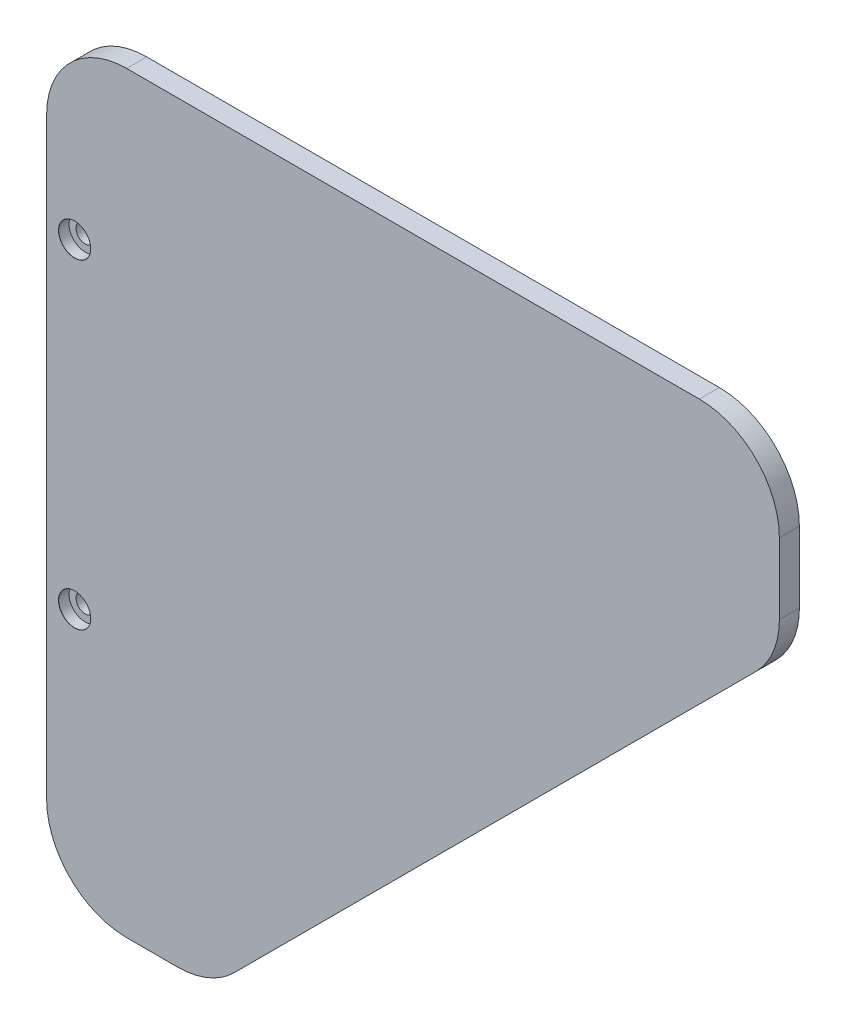
from build123d import *

# Parameters (mm, degrees)
ESTRUSIONE_ESTRUSIONE1_DEPTH                 = 5
FORO_LAMATO_PER_VITE_M4_A_TESTA_CILI_2_COUNT = 2
FORO_LAMATO_PER_VITE_M4_A_TESTA_CILI_2_PITCH = 80


with BuildPart() as part:
    # Schizzo1 → Estrusione-Estrusione1 (new body)
    with BuildSketch(Plane.XY):
        with BuildLine():
            Line((0, 20), (0, 168))
            ThreePointArc((0, 168), (5.857864376, 182.142135624), (20, 188))
            Line((20, 188), (163, 188))
            ThreePointArc((163, 188), (177.142135624, 182.142135624), (183, 168))
            Line((183, 168), (183, 150.284271247))
            ThreePointArc((183, 150.284271247), (181.47759065, 142.6306026), (177.142135624, 136.142135624))
            Line((177.142135624, 136.142135624), (46.857864376, 5.857864376))
            ThreePointArc((46.857864376, 5.857864376), (40.3693974, 1.52240935), (32.715728753, 0))
            Line((32.715728753, 0), (20, 0))
            ThreePointArc((20, 0), (5.857864376, 5.857864376), (0, 20))
        make_face()
    extrude(amount=ESTRUSIONE_ESTRUSIONE1_DEPTH)

    # Schizzo4 → Foro lamato per Vite M4 a testa cilindrica piana-1 (revolve, cut)
    with BuildSketch(Plane(origin=(7, 144.5, 5), x_dir=(0, -1, 0), z_dir=(1, 0, 0))):
        Polygon((0, 0), (0, 5), (2.25, 5), (2.25, 2.6), (4, 2.6), (4, 0.025), (4.025, 0), align=None)
    foro_lamato_per_vite_m4_a_testa_cilindri = revolve(axis=Axis((7, 144.5, 11.35), (0, 0, -1)), mode=Mode.SUBTRACT)

    # Foro lamato per Vite M4 a testa cili 2: Foro lamato per Vite M4 a testa cilindrica piana-1 ×2
    with Locations(*[(0, -i * FORO_LAMATO_PER_VITE_M4_A_TESTA_CILI_2_PITCH, 0) for i in range(1, FORO_LAMATO_PER_VITE_M4_A_TESTA_CILI_2_COUNT)]):
        add(foro_lamato_per_vite_m4_a_testa_cilindri, mode=Mode.SUBTRACT)


solid = part.part
